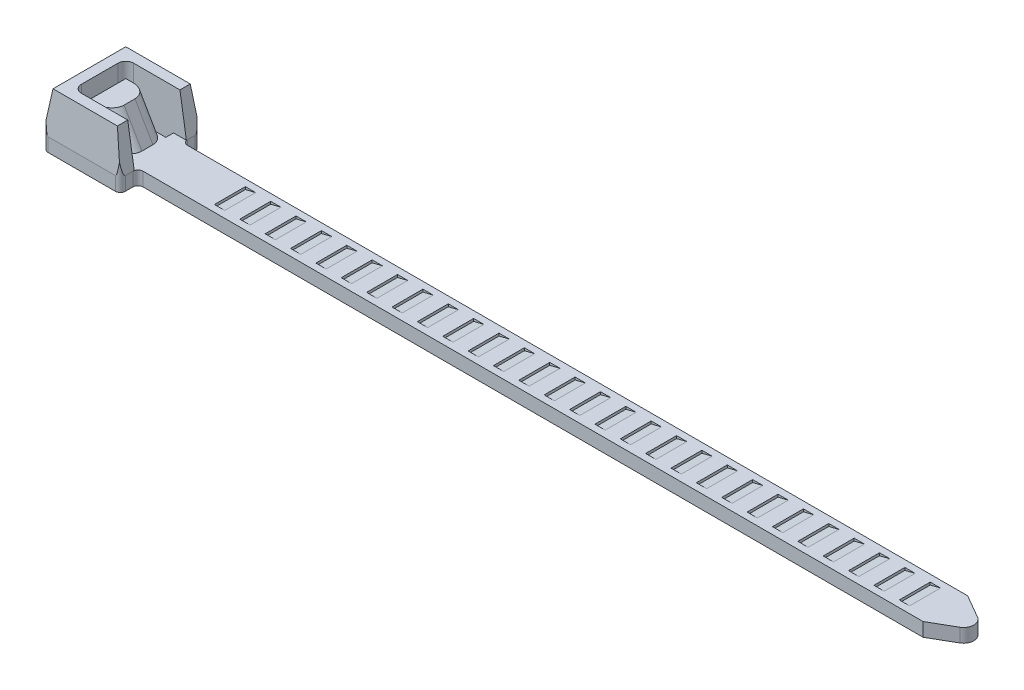
from build123d import *

# Parameters (mm, degrees)
EXTRUDE1_DEPTH      = 3.937
DRAFT1_START        = -3.81
DRAFT1_DEPTH        = 7.62
SKETCH3_W           = 5.969
SKETCH3_H           = 5.144225416
CUT_EXTRUDE1_DEPTH  = 16.999459798
CUT_EXTRUDE2_DEPTH  = 16.999459798
SKETCH5_W           = 3.937
SKETCH5_H           = 3.620225416
EXTRUDE2_DEPTH      = 3.048
DRAFT2_ANGLE        = 30
FILLET1_R           = 1.27
FILLET2_R           = 0.762
SKETCH6_W           = 3.937
SKETCH6_H           = 3.620225416
EXTRUDE3_DEPTH      = 1.3462
CUT_EXTRUDE3_DEPTH  = 16.999459798
SKETCH12_W          = 4.3942
SKETCH12_H          = 1.3462
BOSS_EXTRUDE1_DEPTH = 70
CUT_EXTRUDE8_DEPTH  = 1.524
LPATTERN1_START     = -1.524
LPATTERN1_DEPTH     = 3.048
CUT_EXTRUDE9_DEPTH  = 86.170550743
FILLET3_R           = 1
CUT_EXTRUDE10_DEPTH = 85.172743295
FILLET4_R           = 0.5


# Read off the part's stored shape, not the designer's step: Draft1, LPattern1
with BuildPart() as part:
    # Sketch1 → Extrude1 (new, symmetric)
    with BuildSketch(Plane.XY):
        Polygon((3.81, 1.3462), (3.175, 5.334), (-3.175, 5.334), (-3.81, 1.3462), (-3.81, 0), (14.986, 0), (14.986, 1.3462), align=None)
    extrude(amount=EXTRUDE1_DEPTH, both=True)

    # Draft1 outline → Draft1 (cut)
    with BuildSketch(Plane.YZ.offset(DRAFT1_START)):
        Polygon((1.3462, 3.937), (5.334, 3.588112708), (5.334, 3.937), align=None)
        Polygon((5.334, -3.588112708), (1.3462, -3.937), (5.334, -3.937), align=None)
    extrude(amount=DRAFT1_DEPTH, mode=Mode.SUBTRACT)

    # Sketch3 → Cut-Extrude1 (cut, through all)
    with BuildSketch(Plane(origin=(0, 1.3462, 0), x_dir=(-1, 0, 0), z_dir=(0, 1, 0))):
        with Locations((-0.8255, 0)):
            Rectangle(SKETCH3_W, SKETCH3_H)
    extrude(amount=CUT_EXTRUDE1_DEPTH, mode=Mode.SUBTRACT)

    # Sketch4 → Cut-Extrude2 (cut, through all)
    with BuildSketch(Plane(origin=(0, 1.3462, 0), x_dir=(-1, 0, 0), z_dir=(0, 1, 0))):
        Polygon((2.159, 2.572112708), (-2.54, 2.572112708), (-2.54, 1.810112708), (1.397, 1.810112708), (1.397, -1.810112708), (-2.54, -1.810112708), (-2.54, -2.572112708), (2.159, -2.572112708), align=None)
    extrude(amount=-CUT_EXTRUDE2_DEPTH, mode=Mode.SUBTRACT)

    # Sketch5 → Extrude2 (add)
    with BuildSketch(Plane(origin=(0, 1.3462, 0), x_dir=(-1, 0, 0), z_dir=(0, 1, 0))):
        with Locations((-0.5715, 0)):
            Rectangle(SKETCH5_W, SKETCH5_H)
    extrude(amount=EXTRUDE2_DEPTH)

    # Draft2
    draft2_faces = [part.faces().sort_by_distance(p)[0] for p in [
        (2.54, 2.8702, 0),
    ]]
    draft(draft2_faces, Plane(origin=(14.986, 1.3462, 3.937), x_dir=(1, 0, 0), z_dir=(0, 1, 0)), DRAFT2_ANGLE)

    # Fillet1
    # the kernel refuses this fillet: 1.27 mm, written as the material it takes off along each edge
    with BuildSketch(Plane(origin=(4.1275, -1.403430657, 1.810112708), x_dir=(-0.866025403784438, -0.500000000000001, 0), z_dir=(-0.500000000000001, 0.866025403784438, 0))) as fillet1_piece_1_section:
        with BuildLine():
            CenterArc((FILLET1_R, -FILLET1_R), FILLET1_R, 90, 90)
            Line((0, -FILLET1_R), (0, 0))
            Line((0, 0), (FILLET1_R, 0))
        make_face()
    fillet1_piece_1 = extrude(amount=9.869527241, mode=Mode.PRIVATE)
    fillet1_piece_1 = split(fillet1_piece_1, bisect_by=Plane(origin=(2.54, 0.912532514, 1.637821639), z_dir=(-1, 0, 0)), keep=Keep.TOP, mode=Mode.PRIVATE)
    add(fillet1_piece_1, mode=Mode.SUBTRACT)
    with BuildSketch(Plane(origin=(4.1275, -1.403430657, -1.810112708), x_dir=(-0.8660254037844382, -0.500000000000001, 0), z_dir=(-0.500000000000001, 0.866025403784438, 0))) as fillet1_piece_2_section:
        with BuildLine():
            CenterArc((FILLET1_R, FILLET1_R), FILLET1_R, 180, 90)
            Line((0, FILLET1_R), (0, 0))
            Line((0, 0), (FILLET1_R, 0))
        make_face()
    fillet1_piece_2 = extrude(amount=9.869527241, mode=Mode.PRIVATE)
    fillet1_piece_2 = split(fillet1_piece_2, bisect_by=Plane(origin=(2.54, 0.912532514, -1.637821639), z_dir=(-1, 0, 0)), keep=Keep.TOP, mode=Mode.PRIVATE)
    add(fillet1_piece_2, mode=Mode.SUBTRACT)

    # Fillet2
    fillet2_edges = [part.edges().sort_by_distance(p)[0] for p in [
        (-2.159, 2.667, 2.572112708),
        (-2.159, 2.667, -2.572112708),
    ]]
    fillet(fillet2_edges, radius=FILLET2_R)

    # Sketch6 → Extrude3 (add)
    with BuildSketch(Plane.XZ):
        with Locations((0.5715, 0)):
            Rectangle(SKETCH6_W, SKETCH6_H)
    extrude(amount=-EXTRUDE3_DEPTH)

    # Sketch7 → Cut-Extrude3 (cut, through all)
    with BuildSketch(Plane(origin=(0, 1.3462, 0), x_dir=(-1, 0, 0), z_dir=(0, 1, 0))):
        Polygon((-14.986, 3.937), (-3.81, 3.937), (-10.668, 2.1971), (-14.986, 2.1971), align=None)
        Polygon((-14.986, -3.937), (-3.81, -3.937), (-10.668, -2.1971), (-14.986, -2.1971), align=None)
    extrude(amount=-CUT_EXTRUDE3_DEPTH, mode=Mode.SUBTRACT)

    # Sketch12 → Boss-Extrude1 (add)
    with BuildSketch(Plane(origin=(14.986, 0, 0), x_dir=(0, 0, -1), z_dir=(1, 0, 0))):
        with Locations((0, 0.6731)):
            Rectangle(SKETCH12_W, SKETCH12_H)
    extrude(amount=BOSS_EXTRUDE1_DEPTH)

    # Sketch11 → Cut-Extrude8 (cut, symmetric)
    with BuildSketch(Plane.XY):
        Polygon((10.668, 1.3462), (10.668, 1.0922), (11.684, 1.3462), (11.684, 1.637608524), (10.668, 1.637608524), align=None)
    extrude(amount=CUT_EXTRUDE8_DEPTH, both=True, mode=Mode.SUBTRACT)

    # LPattern1 outline → LPattern1 (cut)
    with BuildSketch(Plane.XY.offset(LPATTERN1_START)):
        Polygon((14.184, 1.3462), (13.168, 1.3462), (13.168, 1.0922), align=None)
        Polygon((79.184, 1.3462), (78.168, 1.3462), (78.168, 1.0922), align=None)
        Polygon((76.684, 1.3462), (75.668, 1.3462), (75.668, 1.0922), align=None)
        Polygon((74.184, 1.3462), (73.168, 1.3462), (73.168, 1.0922), align=None)
        Polygon((71.684, 1.3462), (70.668, 1.3462), (70.668, 1.0922), align=None)
        Polygon((69.184, 1.3462), (68.168, 1.3462), (68.168, 1.0922), align=None)
        Polygon((66.684, 1.3462), (65.668, 1.3462), (65.668, 1.0922), align=None)
        Polygon((64.184, 1.3462), (63.168, 1.3462), (63.168, 1.0922), align=None)
        Polygon((61.684, 1.3462), (60.668, 1.3462), (60.668, 1.0922), align=None)
        Polygon((59.184, 1.3462), (58.168, 1.3462), (58.168, 1.0922), align=None)
        Polygon((56.684, 1.3462), (55.668, 1.3462), (55.668, 1.0922), align=None)
        Polygon((54.184, 1.3462), (53.168, 1.3462), (53.168, 1.0922), align=None)
        Polygon((51.684, 1.3462), (50.668, 1.3462), (50.668, 1.0922), align=None)
        Polygon((49.184, 1.3462), (48.168, 1.3462), (48.168, 1.0922), align=None)
        Polygon((46.684, 1.3462), (45.668, 1.3462), (45.668, 1.0922), align=None)
        Polygon((44.184, 1.3462), (43.168, 1.3462), (43.168, 1.0922), align=None)
        Polygon((41.684, 1.3462), (40.668, 1.3462), (40.668, 1.0922), align=None)
        Polygon((39.184, 1.3462), (38.168, 1.3462), (38.168, 1.0922), align=None)
        Polygon((36.684, 1.3462), (35.668, 1.3462), (35.668, 1.0922), align=None)
        Polygon((34.184, 1.3462), (33.168, 1.3462), (33.168, 1.0922), align=None)
        Polygon((31.684, 1.3462), (30.668, 1.3462), (30.668, 1.0922), align=None)
        Polygon((29.184, 1.3462), (28.168, 1.3462), (28.168, 1.0922), align=None)
        Polygon((26.684, 1.3462), (25.668, 1.3462), (25.668, 1.0922), align=None)
        Polygon((24.184, 1.3462), (23.168, 1.3462), (23.168, 1.0922), align=None)
        Polygon((21.684, 1.3462), (20.668, 1.3462), (20.668, 1.0922), align=None)
        Polygon((19.184, 1.3462), (18.168, 1.3462), (18.168, 1.0922), align=None)
        Polygon((16.684, 1.3462), (15.668, 1.3462), (15.668, 1.0922), align=None)
    extrude(amount=LPATTERN1_DEPTH, mode=Mode.SUBTRACT)

    # Sketch13 → Cut-Extrude9 (cut, through all)
    with BuildSketch(Plane(origin=(0, 1.3462, 0), x_dir=(1, 0, 0), z_dir=(0, 1, 0))):
        Polygon((84.986, -2.1971), (84.986, 0), (81.180511171, -2.1971), align=None)
        Polygon((81.180511171, 2.1971), (84.986, 0), (84.986, 2.1971), align=None)
    extrude(amount=-CUT_EXTRUDE9_DEPTH, mode=Mode.SUBTRACT)

    # Fillet3
    fillet3_edges = [part.edges().sort_by_distance(p)[0] for p in [
        (84.986, 0.6731, 0),
    ]]
    fillet(fillet3_edges, radius=FILLET3_R)

    # Sketch14 → Cut-Extrude10 (cut, through all)
    with BuildSketch(Plane(origin=(0, 1.3462, 0), x_dir=(1, 0, 0), z_dir=(0, 1, 0))):
        Polygon((10.668, 2.1971), (3.81, 2.1971), (3.81, 3.937), align=None)
    cut_extrude10 = extrude(amount=-CUT_EXTRUDE10_DEPTH, mode=Mode.SUBTRACT)

    # Mirror1: Cut-Extrude10 across plane
    add(cut_extrude10.mirror(Plane.XY), mode=Mode.SUBTRACT)

    # Fillet4
    # the kernel refuses this fillet: 0.5 mm, written as the material it adds along each edge
    with BuildSketch(Plane(origin=(3.81, 1.3462, -2.1971), x_dir=(1, 0, 0), z_dir=(0, -1, 0)), Plane(origin=(3.81, 1.3462, 2.1971), x_dir=(0, 0, 1), z_dir=(0, -1, 0))) as fillet4_piece_1:
        with BuildLine():
            CenterArc((FILLET4_R, -FILLET4_R), FILLET4_R, 90, 90)
            Line((0, -FILLET4_R), (0, 0))
            Line((0, 0), (FILLET4_R, 0))
        make_face()
    extrude(amount=1.3462)
    # the kernel refuses this fillet: 0.5 mm, written as the material it takes off along each edge
    with BuildSketch(Plane(origin=(3.81, 2.5962, 3.937), x_dir=(0, 0, -1), z_dir=(0, -1, 0)), Plane(origin=(-3.81, 2.5962, 3.937), x_dir=(1, 0, 0), z_dir=(0, -1, 0)), Plane(origin=(3.81, 2.5962, -3.937), x_dir=(-1, 0, 0), z_dir=(0, -1, 0)), Plane(origin=(-3.81, 2.5962, -3.937), x_dir=(0, 0, 1), z_dir=(0, -1, 0))) as fillet4_2_piece_1:
        with BuildLine():
            CenterArc((FILLET4_R, -FILLET4_R), FILLET4_R, 90, 90)
            Line((0, -FILLET4_R), (0, 0))
            Line((0, 0), (FILLET4_R, 0))
        make_face()
    extrude(amount=3.8462, mode=Mode.SUBTRACT)


solid = part.part
